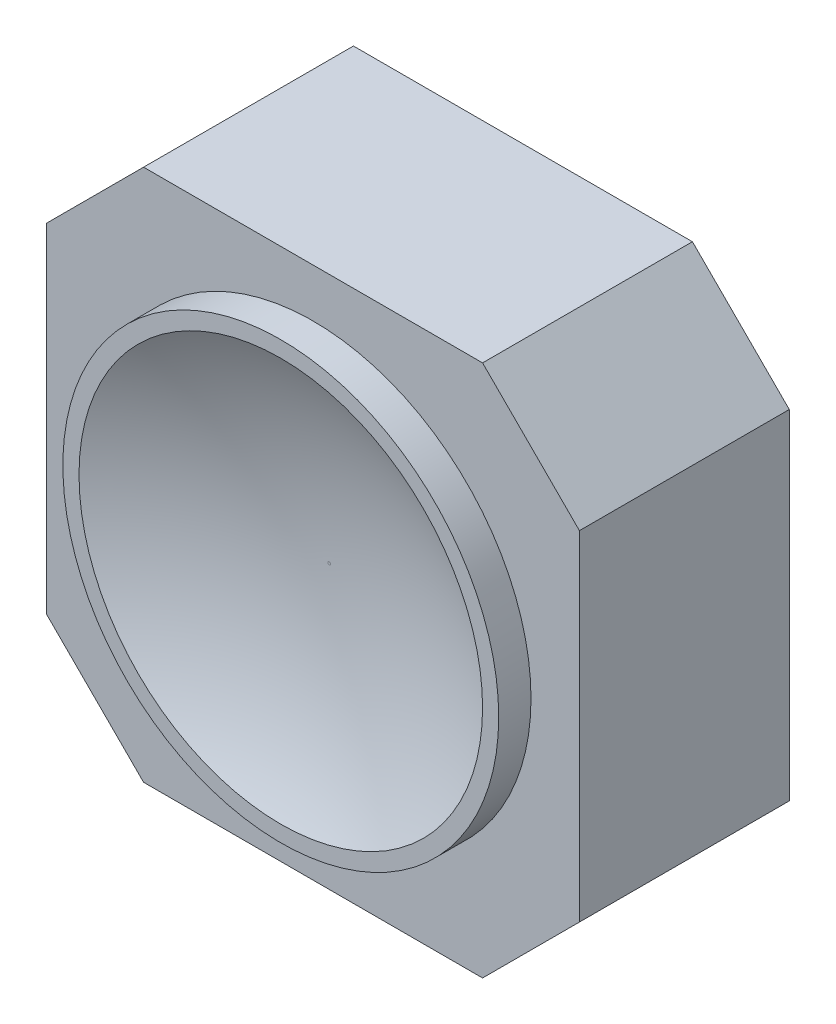
from build123d import *

# Parameters (mm, degrees)
BOSS_EXTRUDE2_DEPTH = 6.5
SKETCH2_R           = 6.25
CUT_EXTRUDE1_DEPTH  = 0.5
BOSS_EXTRUDE6_START = 1
SKETCH8_R           = 6.75
SKETCH8_R_2         = 6.25
BOSS_EXTRUDE6_DEPTH = 1
FILLET5_R           = 13.6
SKETCH3_R           = 6.5
CUT_EXTRUDE2_DEPTH  = 3
SKETCH9_W           = 3.957503607
SKETCH9_H           = 2.75
BOSS_EXTRUDE7_DEPTH = 3


with BuildPart() as part:
    # Sketch1 → Boss-Extrude2 (new body)
    with BuildSketch(Plane.XY):
        Polygon((-8.25, -5.25), (-5.25, -8.25), (5.25, -8.25), (8.25, -5.25), (8.25, 5.25), (5.25, 8.25), (-5.25, 8.25), (-8.25, 5.25), align=None)
    extrude(amount=BOSS_EXTRUDE2_DEPTH)

    # Sketch2 → Cut-Extrude1 (cut)
    with BuildSketch(Plane.XY.offset(6.5)):
        Circle(SKETCH2_R)
    extrude(amount=-CUT_EXTRUDE1_DEPTH, mode=Mode.SUBTRACT)

    # Sketch8 → Boss-Extrude6 (add)
    with BuildSketch(Plane.XY.offset(6.5).offset(BOSS_EXTRUDE6_START)):
        Circle(SKETCH8_R)
        Circle(SKETCH8_R_2, mode=Mode.SUBTRACT)
    extrude(amount=-BOSS_EXTRUDE6_DEPTH)

    # Fillet5
    # the kernel refuses this fillet: 13.6 mm, written as the material it adds along each edge
    with BuildSketch(Plane(origin=(0, 0, 6), x_dir=(1, 0, 0), z_dir=(0, -1, 0))) as fillet5_piece_1:
        with BuildLine():
            CenterArc((0.041135369, 13.6), FILLET5_R, 270, 27.163688564)
            Line((0.041135369, 0), (0.041135369, -0.272))
            Line((0.041135369, -0.272), (6.25, -0.272))
            Line((6.25, -0.272), (6.522, 0))
            ThreePointArc((6.522, 0), (6.522, 0.75), (6.374177293, 1.258))
            Line((6.374177293, 1.258), (6.25, 1.5))
        make_face()
    revolve(axis=Axis((0, 0, 6), (0, 0, 1)))

    # Sketch3 → Cut-Extrude2 (cut)
    with BuildSketch(Plane(origin=(0, 0, 0), x_dir=(-1, 0, 0), z_dir=(0, 0, -1))):
        Circle(SKETCH3_R)
    extrude(amount=-CUT_EXTRUDE2_DEPTH, mode=Mode.SUBTRACT)

    # Sketch9 → Boss-Extrude7 (add)
    with BuildSketch(Plane(origin=(0, 0, 3), x_dir=(-1, 0, 0), z_dir=(0, 0, -1))):
        with Locations((-5.228751803, 0)):
            Rectangle(SKETCH9_W, SKETCH9_H)
        with Locations((5.228751803, 0)):
            Rectangle(SKETCH9_W, SKETCH9_H)
    extrude(amount=BOSS_EXTRUDE7_DEPTH)


solid = part.part
